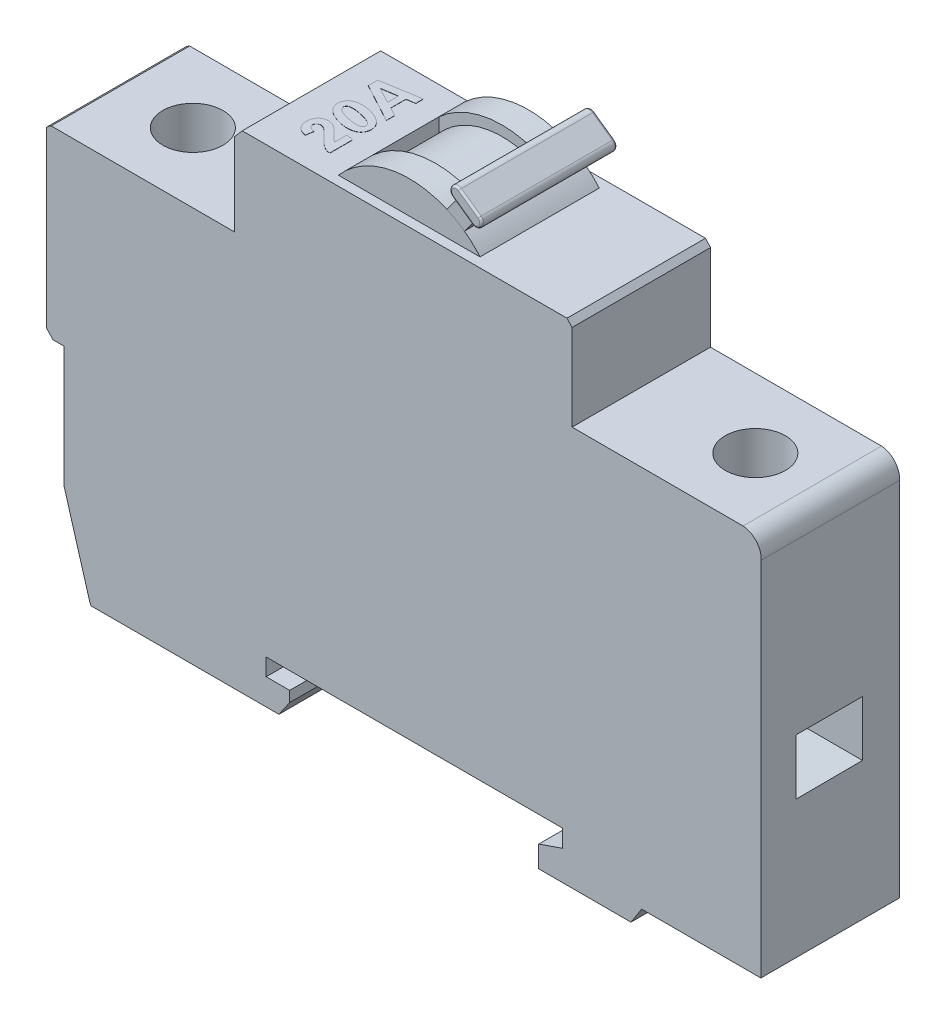
from build123d import *

# Parameters (mm, degrees)
BASE_EXTRUDE_DEPTH  = 17.526
BOSS_EXTRUDE1_DEPTH = 7.5438
SKETCH6_W           = 4.585352887
SKETCH6_H           = 17.1196
BOSS_EXTRUDE2_DEPTH = 1.5748
FILLET1_R           = 0.762
SURFACECUT1_START   = -12.9667
SURFACECUT1_DEPTH   = 8.4074
CUT_EXTRUDE1_DEPTH  = 12.7
CUT_EXTRUDE2_DEPTH  = 12.7
SKETCH11_R          = 3.81
CUT_EXTRUDE3_DEPTH  = 12.7
BOSS_EXTRUDE3_DEPTH = 0.0254
FILLET2_R           = 0.254


# Read off the part's stored shape, not the designer's step: SurfaceCut1
with BuildPart() as part:
    # Sketch4 → Base-Extrude (new body)
    with BuildSketch(Plane.XY):
        with BuildLine():
            Line((-43.1108739, 21.2823044), (-43.1115851, 5.9516264))
            Line((-43.1115851, 5.9516264), (-39.8595215, -5.115179))
            Line((-39.8595215, -5.115179), (-39.6922371, -5.4776878))
            Line((-39.6922371, -5.4776878), (-15.9100393, -5.4776878))
            Line((-15.9100393, -5.4776878), (-14.5504789, -3.5096958))
            Line((-14.5504789, -3.5096958), (-14.5504789, -2.1699728))
            Line((-14.5504789, -2.1699728), (-17.526, -2.1699728))
            Line((-17.526, -2.1699728), (-17.526, 0))
            Line((-17.526, 0), (19.978691698, 0))
            Line((19.978691698, 0), (19.976980769, -2.221707468))
            Line((19.976980769, -2.221707468), (16.978429487, -3.2496226))
            Line((16.978429487, -3.2496226), (16.976333351, -5.971536593))
            Line((16.976333351, -5.971536593), (28.652176489, -5.980528115))
            Line((28.652176489, -5.980528115), (30.006304604, -3.875141931))
            Line((30.006304604, -3.875141931), (45.095964006, -3.878905548))
            Line((45.095964006, -3.878905548), (45.131419847, 41.927212182))
            ThreePointArc((45.131419847, 41.927212182), (44.524638363, 43.707284862), (42.840966345, 44.545193599))
            Line((42.840966345, 44.545193599), (21.1962873, 44.561862083))
            Line((21.1962873, 44.561862083), (21.1962873, 55.4834552))
            Line((21.1962873, 55.4834552), (20.5566899, 56.1850794))
            Line((20.5566899, 56.1850794), (-20.5566899, 56.168798))
            Line((-20.5566899, 56.168798), (-21.5489155, 55.0074338))
            Line((-21.5489155, 55.0074338), (-21.5489155, 44.59478))
            Line((-21.5489155, 44.59478), (-44.7358897, 44.6126362))
            ThreePointArc((-44.7358897, 44.6126362), (-45.050776644, 44.408818509), (-45.3388095, 44.1685426))
            Line((-45.3388095, 44.1685426), (-45.3448801, 22.1785942))
            Line((-45.3448801, 22.1785942), (-44.5043179, 21.2826092))
            Line((-44.5043179, 21.2826092), (-43.1108739, 21.2823044))
        make_face()
    extrude(amount=-BASE_EXTRUDE_DEPTH)

    # Sketch5 → Boss-Extrude1 (add, symmetric)
    with BuildSketch(Plane.XY.offset(-8.763)):
        with BuildLine():
            Line((8.1232121, 60.3592138), (6.0349765, 61.8285276))
            Line((6.0349765, 61.8285276), (4.11741144, 59.294256494))
            ThreePointArc((4.11741144, 59.294256494), (-3.258355843, 59.995365429), (-9.605327588, 56.173134873))
            Line((-9.605327588, 56.173134873), (8.331270528, 56.180237985))
            ThreePointArc((8.331270528, 56.180237985), (7.391479006, 57.152713107), (6.346867553, 58.011609423))
            Line((6.346867553, 58.011609423), (8.1232121, 60.3592138))
        make_face()
    extrude(amount=BOSS_EXTRUDE1_DEPTH, both=True)

    # Sketch6 → Boss-Extrude2 (add)
    with BuildSketch(Plane(origin=(31.096277861, 44.195021143, 0), x_dir=(-0.8178405777297407, 0.5754448621881024, 0), z_dir=(0.5754448621881024, 0.8178405777297407, 0))):
        with Locations((29.366583434, -8.763)):
            Rectangle(SKETCH6_W, SKETCH6_H)
    extrude(amount=BOSS_EXTRUDE2_DEPTH)

    # Fillet1
    fillet1_edges = [part.edges().sort_by_distance(p)[0] for p in [
        (5.204050473, 62.41317958, -8.763),
        (8.954138127, 59.77456182, -8.763),
        (6.110261042, 63.701114922, -8.763),
        (9.860348696, 61.062497162, -8.763),
    ]]
    fillet(fillet1_edges, radius=FILLET1_R)

    # SurfaceCut1 outline → SurfaceCut1 (cut)
    with BuildSketch(Plane.XY.offset(SURFACECUT1_START)):
        with BuildLine():
            ThreePointArc((-8.642491903, 55.344975804), (-2.976698197, 58.756991911), (3.6074773, 58.13112831))
            Line((3.6074773, 58.13112831), (3.606933624, 59.504006089))
            ThreePointArc((3.606933624, 59.504006089), (-2.850892531, 60.080530922), (-8.643213702, 57.167643182))
            Line((-8.643213702, 57.167643182), (-8.642491903, 55.344975804))
        make_face()
    extrude(amount=SURFACECUT1_DEPTH, mode=Mode.SUBTRACT)

    # Sketch8 → Cut-Extrude1 (cut)
    with BuildSketch(Plane(origin=(-43.111861107, 0.001999987, 0), x_dir=(0, 0, 1), z_dir=(-0.9999999989239542, 4.639064228368602e-05, 0))):
        Polygon((-4.405114179, 13.568690088), (-12.851909586, 13.611798608), (-12.824841, 20.623661033), (-4.405114179, 20.623661033), align=None)
    extrude(amount=-CUT_EXTRUDE1_DEPTH, mode=Mode.SUBTRACT)

    # Sketch10 → Cut-Extrude2 (cut)
    with BuildSketch(Plane(origin=(45.098939419, -0.034908456, 0), x_dir=(0, 0, -1), z_dir=(0.9999997004299298, -0.00077404137524658, 0))):
        Polygon((12.824841, 20.60152636), (4.405114179, 20.60152636), (4.405114179, 13.546557283), (12.851909586, 13.589665791), align=None)
    extrude(amount=-CUT_EXTRUDE2_DEPTH, mode=Mode.SUBTRACT)

    # Sketch11 → Cut-Extrude3 (cut)
    with BuildSketch(Plane(origin=(0.034329469, 44.578158826, 0), x_dir=(-0.9999997034760774, 0.0007700959405562207, 0), z_dir=(0.0007700959405562207, 0.9999997034760774, 0))):
        with Locations((35.5981, -8.763)):
            Circle(SKETCH11_R)
        with Locations((-35.5981, -8.763)):
            Circle(SKETCH11_R)
    extrude(amount=-CUT_EXTRUDE3_DEPTH, mode=Mode.SUBTRACT)

    # Sketch13 → Boss-Extrude3 (add)
    # profile 1 of 3: a face of its own
    with BuildSketch(Plane(origin=(36.267421444, 56.191301041, 25.870118279), x_dir=(0, 0, -1), z_dir=(-0.0003960121693365521, 0.9999999215871779, 0))):
        with BuildLine():
            Line((30.314488492, 52.187423702), (29.362325878, 52.333223603))
            add(Edge.make_bspline(
                [(29.362325878, 52.333223603), (29.372758349, 52.389935954), (29.393104504, 52.500540462), (29.436562709, 52.660113723), (29.487334668, 52.810069782), (29.548849651, 52.949623545), (29.620807413, 53.078076666), (29.701164533, 53.197080216), (29.791938037, 53.305346768), (29.891166974, 53.404098189), (29.999183217, 53.491065049), (30.114011866, 53.566588178), (30.234455025, 53.632368147), (30.363123885, 53.683125523), (30.49746353, 53.723934725), (30.638006729, 53.754210969), (30.785540863, 53.770758884), (30.88607766, 53.773144492), (30.937361535, 53.774361392)],
                knots=[0, 0, 0, 0, 1.176560694, 2.294613297, 3.37234743, 4.405619833, 5.402576082, 6.374013457, 7.332234665, 8.281838666, 9.227212998, 10.157436275, 11.084349095, 12.022955127, 12.97507356, 13.947892898, 14.95321905, 16, 16, 16, 16], degree=3))
            add(Edge.make_bspline(
                [(30.937361535, 53.774361392), (30.993270044, 53.773160882), (31.102045354, 53.770825174), (31.26081092, 53.754374937), (31.409925698, 53.72412085), (31.550438416, 53.684219866), (31.681041604, 53.630944014), (31.803371552, 53.567664638), (31.915496485, 53.490899064), (32.017679377, 53.40323009), (32.109592797, 53.30772337), (32.189791694, 53.204696583), (32.257297784, 53.095139904), (32.313405471, 52.979699511), (32.356182173, 52.857463105), (32.386583676, 52.729160123), (32.406309843, 52.594354877), (32.408253953, 52.502237077), (32.409246242, 52.455219438)],
                knots=[0, 0, 0, 0, 1.205999613, 2.34638671, 3.437311622, 4.484516006, 5.49231974, 6.474825341, 7.450004718, 8.416145608, 9.374490329, 10.304583212, 11.226850936, 12.14547179, 13.067987639, 14.014154949, 14.986409304, 16, 16, 16, 16], degree=3))
            add(Edge.make_bspline(
                [(32.409246242, 52.455219438), (32.407990247, 52.406205798), (32.405474256, 52.30802248), (32.382376889, 52.160887331), (32.345747778, 52.013760161), (32.293287741, 51.865825941), (32.225593865, 51.71562698), (32.137793075, 51.563929801), (32.033778515, 51.407061965), (31.95252591, 51.305716371), (31.910352706, 51.253114137)],
                knots=[0, 0, 0, 0, 0.88481403, 1.772444921, 2.683471917, 3.620264019, 4.603781152, 5.654851415, 6.782778345, 8, 8, 8, 8], degree=3))
            add(Edge.make_bspline(
                [(31.910352706, 51.253114137), (31.893153471, 51.233285837), (31.856615407, 51.191162586), (31.798783411, 51.124125898), (31.730284085, 51.05393608), (31.657898062, 50.974333284), (31.574485933, 50.892041766), (31.486150534, 50.80119315), (31.388026312, 50.706236697), (31.286232165, 50.60668025), (31.184079043, 50.509504257), (31.09025065, 50.41684604), (31.00458263, 50.333580417), (30.928144262, 50.258263638), (30.861104571, 50.190744438), (30.802184119, 50.132616974), (30.753511801, 50.0817643), (30.676902042, 49.999510219), (30.572119845, 49.878373852), (30.485298899, 49.767703314), (30.441443507, 49.711800906)],
                knots=[0, 0, 0, 0, 0.665174907, 1.413097954, 2.24279202, 3.149643092, 4.138963606, 5.211218311, 6.360529316, 7.598766324, 8.819333918, 9.933103059, 10.940247435, 11.84663401, 12.652293758, 13.351322069, 13.943837409, 14.435847888, 16.199659217, 18, 18, 18, 18], degree=3))
            Line((30.441443507, 49.711800906), (32.028381197, 49.711800906))
            Line((32.028381197, 49.711800906), (31.837948674, 48.8231158))
            Line((31.837948674, 48.8231158), (28.917983325, 48.8231158))
            add(Edge.make_bspline(
                [(28.917983325, 48.8231158), (28.927117482, 48.883179962), (28.945300072, 49.002744577), (28.992400366, 49.177913405), (29.051347138, 49.34910051), (29.126375926, 49.514878536), (29.21423625, 49.675139854), (29.310884097, 49.830969515), (29.418856173, 49.980263705), (29.518119508, 50.101837308), (29.607483254, 50.203144512), (29.68868474, 50.289319453), (29.781148698, 50.387598447), (29.888209815, 50.495145026), (30.005426314, 50.615962116), (30.137945161, 50.74496364), (30.281570707, 50.886334539), (30.382176855, 50.983423702), (30.434500654, 51.033918369)],
                knots=[0, 0, 0, 0, 1.063730775, 2.117478306, 3.172689597, 4.233134709, 5.301052612, 6.373125639, 7.443804969, 8.526715156, 9.121778271, 9.810345173, 10.601138625, 11.485912787, 12.468987183, 13.550362503, 14.725979039, 16, 16, 16, 16], degree=3))
            add(Edge.make_bspline(
                [(30.434500654, 51.033918369), (30.473598883, 51.0718512), (30.548101125, 51.144132761), (30.652980344, 51.248541385), (30.747159812, 51.341818866), (30.830788472, 51.423824064), (30.902349806, 51.496423092), (30.96243158, 51.558979678), (31.012594555, 51.610048033), (31.040939612, 51.641823896), (31.053406354, 51.655799576)],
                knots=[0, 0, 0, 0, 1.489933264, 2.839089461, 4.047578686, 5.115401406, 6.042558295, 6.835521558, 7.487838325, 8, 8, 8, 8], degree=3))
            add(Edge.make_bspline(
                [(31.053406354, 51.655799576), (31.089084416, 51.697857386), (31.156499733, 51.777327524), (31.247217033, 51.893611766), (31.316810359, 52.003470317), (31.370738504, 52.104449912), (31.409146626, 52.199503745), (31.435661506, 52.288910866), (31.454403048, 52.373443615), (31.456213714, 52.42868118), (31.457083628, 52.455219438)],
                knots=[0, 0, 0, 0, 1.447764524, 2.735616712, 3.867084987, 4.856905771, 5.736767602, 6.552173182, 7.304408147, 8, 8, 8, 8], degree=3))
            add(Edge.make_bspline(
                [(31.457083628, 52.455219438), (31.455519172, 52.49473373), (31.452495344, 52.571108159), (31.425106774, 52.679353921), (31.381051457, 52.776662658), (31.318264161, 52.859336113), (31.242815038, 52.927671826), (31.155701806, 52.977536379), (31.057928261, 53.007183668), (30.989473963, 53.010779561), (30.954222748, 53.012631301)],
                knots=[0, 0, 0, 0, 1.125749503, 2.175882966, 3.163483604, 4.153963288, 5.115958572, 6.049648829, 6.995647438, 8, 8, 8, 8], degree=3))
            add(Edge.make_bspline(
                [(30.954222748, 53.012631301), (30.918246718, 53.010650229), (30.846639741, 53.006707089), (30.743605181, 52.971124964), (30.64838737, 52.91351164), (30.575539147, 52.849085426), (30.523936476, 52.783644511), (30.485763072, 52.725418092), (30.450424265, 52.657944991), (30.417760865, 52.581284895), (30.388469033, 52.495550572), (30.360335979, 52.401070271), (30.336179365, 52.297236164), (30.321876424, 52.224825933), (30.314488492, 52.187423702)],
                knots=[0, 0, 0, 0, 1.131594318, 2.252334341, 3.392871184, 4.625570627, 5.29301933, 6.01580277, 6.817825761, 7.691063802, 8.640488087, 9.672865114, 10.797959421, 12, 12, 12, 12], degree=3))
        make_face()
    # profile 2 of 3: a face of its own
    with BuildSketch(Plane(origin=(36.267421444, 56.191301041, 25.870118279), x_dir=(0, 0, -1), z_dir=(-0.0003960121693365521, 0.9999999215871779, 0))):
        with BuildLine():
            add(Edge.make_bspline(
                [(32.790111288, 50.440800407), (32.790880506, 50.502643765), (32.792424452, 50.626773473), (32.804799527, 50.813070139), (32.824494415, 51.000044321), (32.852845153, 51.187493452), (32.886668955, 51.37607276), (32.931490097, 51.564575878), (32.98087227, 51.754352427), (33.0215636, 51.879481085), (33.042037646, 51.942440196)],
                knots=[0, 0, 0, 0, 0.970599455, 1.948151449, 2.929222993, 3.920683182, 4.923216955, 5.935254264, 6.961112842, 8, 8, 8, 8], degree=3))
            add(Edge.make_bspline(
                [(33.042037646, 51.942440196), (33.068211988, 52.017379635), (33.119328942, 52.163731962), (33.204174711, 52.373971348), (33.295691476, 52.568753303), (33.391867756, 52.74916099), (33.493532692, 52.914723319), (33.601218496, 53.065538201), (33.713744631, 53.201636545), (33.832519872, 53.322423987), (33.955618426, 53.428412368), (34.081637749, 53.521728752), (34.212208494, 53.599124304), (34.345558433, 53.663117492), (34.482364766, 53.713162759), (34.622509491, 53.749015697), (34.766508181, 53.770417186), (34.863638406, 53.773038795), (34.912640448, 53.774361392)],
                knots=[0, 0, 0, 0, 1.358415845, 2.652906483, 3.878018659, 5.039959068, 6.150158853, 7.20059872, 8.209053629, 9.169323666, 10.096050888, 10.986717513, 11.849391753, 12.689636966, 13.514830071, 14.338236537, 15.161643003, 16, 16, 16, 16], degree=3))
            add(Edge.make_bspline(
                [(34.912640448, 53.774361392), (34.961306715, 53.772982726), (35.057066761, 53.77026994), (35.197405445, 53.750206249), (35.331224491, 53.716679006), (35.457977615, 53.668323945), (35.57877596, 53.607928179), (35.692526232, 53.532899989), (35.798800758, 53.443931567), (35.898280927, 53.342667777), (35.988663284, 53.22869514), (36.067564975, 53.101610931), (36.133728528, 52.962030105), (36.188622107, 52.810679866), (36.229514537, 52.646658185), (36.260472892, 52.471081621), (36.278144309, 52.282671673), (36.280275401, 52.153076539), (36.281374206, 52.086256425)],
                knots=[0, 0, 0, 0, 0.952698764, 1.874614249, 2.769565738, 3.648475805, 4.525691551, 5.409072292, 6.310044174, 7.234751044, 8.184100811, 9.152332782, 10.157077687, 11.203502, 12.299436301, 13.462706091, 14.691754367, 16, 16, 16, 16], degree=3))
            add(Edge.make_bspline(
                [(36.281374206, 52.086256425), (36.280774817, 52.023080588), (36.279565176, 51.895583857), (36.264356656, 51.703071449), (36.243127527, 51.507767916), (36.211954286, 51.3095981), (36.172216329, 51.10919077), (36.124729726, 50.905507019), (36.066646631, 50.700056318), (36.002440033, 50.493548694), (35.929905632, 50.292222835), (35.85053505, 50.100569051), (35.765908998, 49.920527175), (35.672996233, 49.753925806), (35.57609214, 49.598215586), (35.472128207, 49.454954511), (35.360526594, 49.32508924), (35.24465523, 49.206642396), (35.124098554, 49.101099609), (34.998075637, 49.010678171), (34.869369668, 48.932261619), (34.735507957, 48.870301873), (34.598963435, 48.819261031), (34.45770735, 48.785358352), (34.312934378, 48.76348404), (34.215129087, 48.760927849), (34.165787898, 48.759638292)],
                knots=[0, 0, 0, 0, 1.05084589, 2.120738275, 3.211093578, 4.318915938, 5.457009554, 6.609776757, 7.797550827, 9.008383764, 10.207225413, 11.356430647, 12.458708487, 13.514953527, 14.528319611, 15.508616287, 16.45665315, 17.374611646, 18.263601967, 19.1185347, 19.952452517, 20.766932184, 21.56913463, 22.373596911, 23.179505917, 24, 24, 24, 24], degree=3))
            add(Edge.make_bspline(
                [(34.165787898, 48.759638292), (34.116791451, 48.761006837), (34.020701355, 48.76369078), (33.880016613, 48.783755792), (33.74596342, 48.817534047), (33.618693348, 48.865406205), (33.497469586, 48.926305357), (33.383279745, 49.001130338), (33.275335303, 49.088968986), (33.175309757, 49.190399343), (33.083731052, 49.303984901), (33.004959775, 49.431435736), (32.938894112, 49.570701259), (32.883920826, 49.721750909), (32.841918833, 49.884580709), (32.810976608, 50.059275087), (32.793372226, 50.246035897), (32.791218991, 50.374641153), (32.790111288, 50.440800407)],
                knots=[0, 0, 0, 0, 0.959716946, 1.882162852, 2.777629248, 3.663106967, 4.540827416, 5.430134807, 6.332508897, 7.262293894, 8.216222756, 9.185011796, 10.190334778, 11.231272623, 12.329462361, 13.480643168, 14.703950571, 16, 16, 16, 16], degree=3))
        make_face()
        with BuildLine():
            add(Edge.make_bspline(
                [(33.742273902, 50.24144136), (33.742625687, 50.209692942), (33.743304276, 50.148450685), (33.749280323, 50.060050999), (33.758962338, 49.978898496), (33.772432714, 49.905192737), (33.790911045, 49.839159052), (33.810662767, 49.779386586), (33.836571444, 49.727408473), (33.875960686, 49.669900987), (33.933003437, 49.611135398), (34.012076885, 49.559039675), (34.100872908, 49.526363366), (34.163526155, 49.523057655), (34.19554298, 49.521368383)],
                knots=[0, 0, 0, 0, 1.190845118, 2.297123686, 3.321617473, 4.255641247, 5.104064859, 5.892442402, 6.613463828, 7.273918372, 8.501773615, 9.657552434, 10.802971309, 12, 12, 12, 12], degree=3))
            add(Edge.make_bspline(
                [(34.19554298, 49.521368383), (34.217422064, 49.522114914), (34.261172726, 49.523607719), (34.325331184, 49.53612958), (34.388238934, 49.554820847), (34.44822447, 49.582920005), (34.50667123, 49.618249919), (34.563204943, 49.661066806), (34.618109577, 49.711845874), (34.651492106, 49.750469132), (34.668648778, 49.770319233)],
                knots=[0, 0, 0, 0, 0.948578972, 1.896832437, 2.827118289, 3.790017463, 4.761852259, 5.786166786, 6.862218838, 8, 8, 8, 8], degree=3))
            add(Edge.make_bspline(
                [(34.668648778, 49.770319233), (34.692156241, 49.800922569), (34.742495055, 49.866456463), (34.807666265, 49.981627484), (34.870610594, 50.116392849), (34.933230632, 50.270548222), (34.99308105, 50.445223967), (35.051307867, 50.639847053), (35.107991199, 50.854508399), (35.141919812, 51.0050363), (35.159607626, 51.083510172)],
                knots=[0, 0, 0, 0, 0.655059745, 1.40274305, 2.242041047, 3.181963106, 4.228381407, 5.378256922, 6.633221284, 8, 8, 8, 8], degree=3))
            add(Edge.make_bspline(
                [(35.159607626, 51.083510172), (35.173017065, 51.146618645), (35.199094457, 51.26934596), (35.233970208, 51.448478662), (35.262837304, 51.617835248), (35.28648299, 51.776911556), (35.305977059, 51.925960156), (35.318530208, 52.064615574), (35.327134951, 52.193268378), (35.328536641, 52.27568484), (35.329211592, 52.315370554)],
                knots=[0, 0, 0, 0, 1.243133213, 2.417526402, 3.516130667, 4.5530903, 5.516278402, 6.41196453, 7.235318791, 8, 8, 8, 8], degree=3))
            add(Edge.make_bspline(
                [(35.329211592, 52.315370554), (35.328848561, 52.345134325), (35.328145923, 52.402741518), (35.322285571, 52.485879605), (35.312260697, 52.562670466), (35.299392698, 52.632995996), (35.279382358, 52.696156094), (35.258769311, 52.754043576), (35.231577402, 52.804574292), (35.192496207, 52.862343842), (35.135505613, 52.92169934), (35.056500372, 52.975361318), (34.966879989, 53.007430334), (34.903965729, 53.010878157), (34.87197517, 53.012631301)],
                knots=[0, 0, 0, 0, 1.141527622, 2.209404226, 3.194003136, 4.111655093, 4.946067315, 5.732667855, 6.464411274, 7.139700502, 8.404259517, 9.592985437, 10.776084462, 12, 12, 12, 12], degree=3))
            add(Edge.make_bspline(
                [(34.87197517, 53.012631301), (34.851113649, 53.011765756), (34.809768329, 53.010050337), (34.748417365, 52.999415816), (34.689634642, 52.978503055), (34.631783278, 52.952421415), (34.577024204, 52.916468908), (34.522707514, 52.874662395), (34.470554896, 52.824366225), (34.438846822, 52.786149316), (34.422673436, 52.766655959)],
                knots=[0, 0, 0, 0, 0.943746662, 1.870405658, 2.801756019, 3.758205726, 4.73282665, 5.755564179, 6.855177262, 8, 8, 8, 8], degree=3))
            add(Edge.make_bspline(
                [(34.422673436, 52.766655959), (34.398246264, 52.734350864), (34.34705749, 52.666653375), (34.279126183, 52.550795067), (34.213059938, 52.419204259), (34.149701872, 52.270283584), (34.088362159, 52.104832629), (34.030495672, 51.921868077), (33.973537969, 51.722591635), (33.940107311, 51.583203564), (33.922788064, 51.510991512)],
                knots=[0, 0, 0, 0, 0.713524343, 1.495238028, 2.363281769, 3.308503121, 4.346834518, 5.473124264, 6.69091466, 8, 8, 8, 8], degree=3))
            add(Edge.make_bspline(
                [(33.922788064, 51.510991512), (33.908268003, 51.447910679), (33.879901115, 51.324673805), (33.843575339, 51.143704181), (33.812312564, 50.971494742), (33.787858535, 50.808344658), (33.767832769, 50.653939572), (33.752315634, 50.508838852), (33.744451232, 50.372121886), (33.742984626, 50.284098107), (33.742273902, 50.24144136)],
                knots=[0, 0, 0, 0, 1.209045138, 2.362031945, 3.447412557, 4.478002037, 5.443142206, 6.355656672, 7.203143308, 8, 8, 8, 8], degree=3))
        make_face(mode=Mode.SUBTRACT)
    # profile 3 of 3: a face of its own
    with BuildSketch(Plane(origin=(36.267421444, 56.191301041, 25.870118279), x_dir=(0, 0, -1), z_dir=(-0.0003960121693365521, 0.9999999215871779, 0))):
        Polygon((39.67047801, 49.902233429), (37.7363977, 49.902233429), (37.170059312, 48.8231158), (36.103835552, 48.8231158), (38.771874543, 53.774361392), (39.974971679, 53.774361392), (40.798195606, 48.8231158), (39.836114631, 48.8231158), align=None)
        Polygon((39.543522995, 50.727441028), (39.233078309, 52.758721271), (38.167846385, 50.727441028), align=None, mode=Mode.SUBTRACT)
    extrude(amount=BOSS_EXTRUDE3_DEPTH)

    # Fillet2
    fillet2_edges = [part.edges().sort_by_distance(p)[0] for p in [
        (7.985304869, 62.381806042, -0.2032),
        (7.985304869, 62.381806042, -17.3228),
        (7.0790943, 61.0938707, -17.3228),
        (5.657155758, 63.057147251, -17.3228),
        (9.407243411, 60.418529491, -17.3228),
        (6.164360041, 63.390155023, -17.3228),
        (5.515010372, 62.467278579, -17.3228),
        (8.900039128, 60.085521719, -17.3228),
        (9.549388797, 61.008398163, -17.3228),
        (9.407243411, 60.418529491, -0.2032),
        (7.0790943, 61.0938707, -0.2032),
        (5.657155758, 63.057147251, -0.2032),
        (6.164360041, 63.390155023, -0.2032),
        (5.515010372, 62.467278579, -0.2032),
        (8.900039128, 60.085521719, -0.2032),
        (9.549388797, 61.008398163, -0.2032),
    ]]
    fillet(fillet2_edges, radius=FILLET2_R)


solid = part.part
